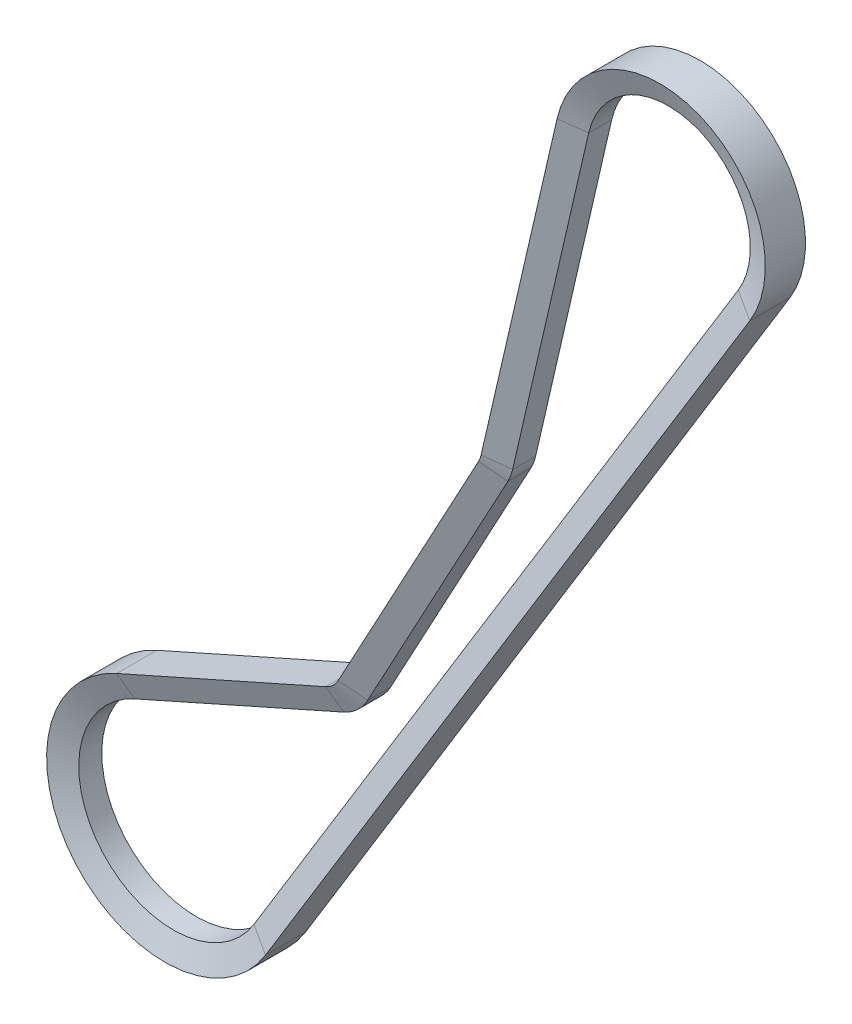
from build123d import *


with BuildPart() as part:
    # Sweep1: sweep along a path in Sketch2
    with BuildLine(Plane.XY) as sweep1_path:
        Line((21.324299092, -13.048918279), (-93.495504875, -200.685302322))
        ThreePointArc((-93.495504875, -200.685302322), (-138.425072415, -204.538081206), (-128.765396053, -160.490373014))
        Line((-128.765396053, -160.490373014), (-79.236623307, -138.443266189))
        ThreePointArc((-79.236623307, -138.443266189), (-77.502949868, -137.299798359), (-76.230943254, -135.658109763))
        Line((-76.230943254, -135.658109763), (-42.983102949, -74.057938375))
        ThreePointArc((-42.983102949, -74.057938375), (-42.630147945, -73.284063791), (-42.383784776, -72.469960422))
        Line((-42.383784776, -72.469960422), (-24.359581575, 5.622346974))
        ThreePointArc((-24.359581575, 5.622346974), (9.458185422, 23.141796139), (21.324299092, -13.048918279))
    # Sketch3 → Sweep1 (sweep)
    with BuildSketch(Plane(origin=(-24.359581575, 5.622346974, 0), x_dir=(0.9743832629934427, -0.2248938789701745, 0), z_dir=(0.2248938789701745, 0.9743832629934427, 0))):
        Polygon((0, -4.7625), (0, 4.7625), (5.588, 2.728634331), (5.588, -2.728634331), align=None)
    sweep(path=sweep1_path.line)


solid = part.part
